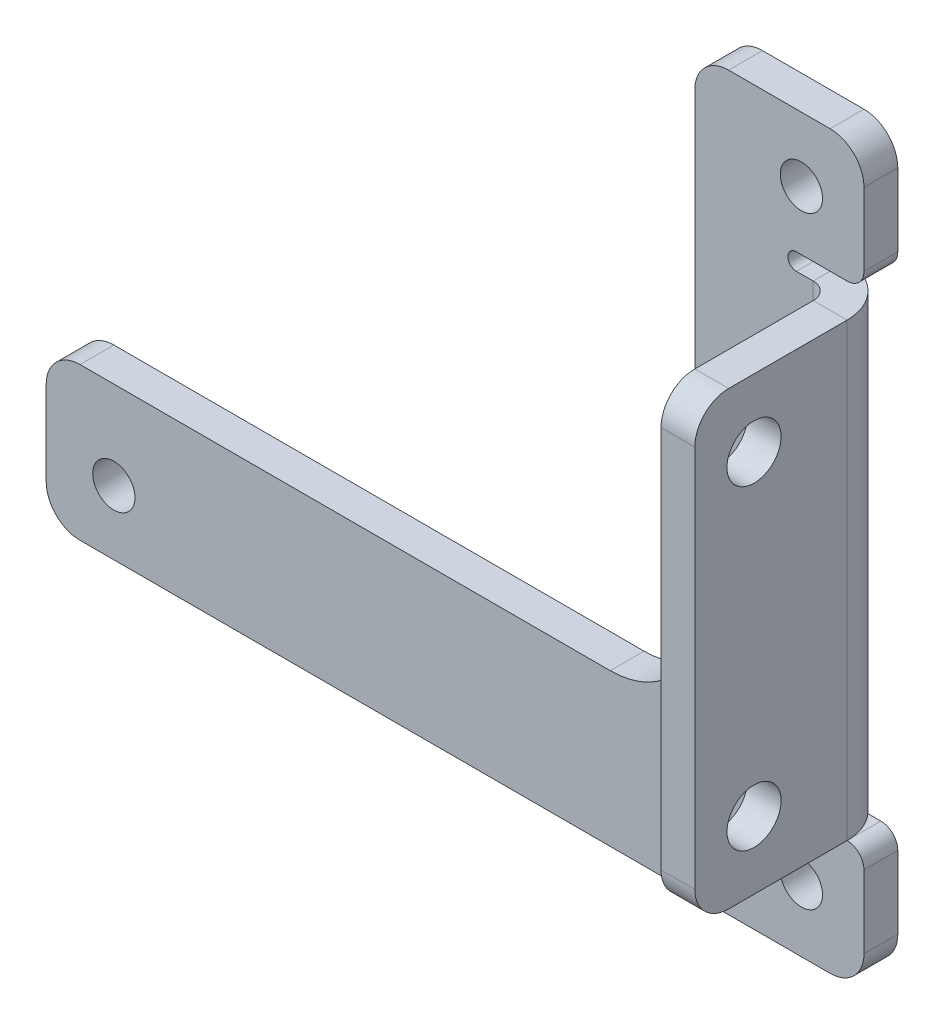
from build123d import *

# Parameters (mm, degrees)
SKETCH1_W                 = 48.35
SKETCH1_H                 = 43.25
BOSS_EXTRUDE2_DEPTH       = 2
EDGE_FLANGE1_START        = -4
EDGE_FLANGE1_OUTLINE_W    = 1
EDGE_FLANGE1_OUTLINE_H    = 2
EDGE_FLANGE1_DEPTH        = 4
EDGE_FLANGE1_START_2      = -1
EDGE_FLANGE1_2_DEPTH      = 3.09178
EDGE_FLANGE1_START_3      = 2
EDGE_FLANGE1_3_OUTLINE_W  = 2
EDGE_FLANGE1_3_OUTLINE_H  = 26.65
EDGE_FLANGE1_3_DEPTH      = 10
EDGE_FLANGE1_START_4      = 8.3
EDGE_FLANGE1_4_DEPTH      = 26.65
EDGE_FLANGE1_5_DEPTH      = 26.65
EDGE_FLANGE1_START_5      = 46.35
EDGE_FLANGE1_6_OUTLINE_R  = 1.6
EDGE_FLANGE1_6_DEPTH      = 2
REDONDEO1_R               = 2
TALADRO_ROSCADO_M31_D     = 2.5
TALADRO_ROSCADO_M31_DEPTH = 8.5
TALADRO_ROSCADO_M31_TIP   = 0.751075774
CROQUIS4_W                = 38.35
CROQUIS4_H                = 34.25
CORTAR_EXTRUIR1_DEPTH     = 66.637527376
FILLET1_R                 = 2
REDONDEO2_R               = 5
REDONDEO3_R               = 1


with BuildPart() as part:
    # Sketch1 → Boss-Extrude2 (new body)
    with BuildSketch(Plane.XY):
        with Locations((24.175, 21.625)):
            Rectangle(SKETCH1_W, SKETCH1_H)
    extrude(amount=BOSS_EXTRUDE2_DEPTH)

    # Edge-Flange1: read off the stored shape, not the designer's step
    # Edge-Flange1 outline → Edge-Flange1 (cut)
    with BuildSketch(Plane(origin=(48.35, 0, 2), x_dir=(0, 1, 0), z_dir=(1, 0, 0)).offset(EDGE_FLANGE1_START)):
        with Locations((35.45, -1)):
            Rectangle(EDGE_FLANGE1_OUTLINE_W, EDGE_FLANGE1_OUTLINE_H)
        with Locations((7.8, -1)):
            Rectangle(EDGE_FLANGE1_OUTLINE_W, EDGE_FLANGE1_OUTLINE_H)
    extrude(amount=EDGE_FLANGE1_DEPTH, mode=Mode.SUBTRACT)

    # Edge-Flange1 2 outline → Edge-Flange1 2 (cut)
    with BuildSketch(Plane.XY.offset(EDGE_FLANGE1_START_2)):
        with BuildLine():
            Line((44.35, 7.3), (44.35, 8.3))
            ThreePointArc((44.35, 8.3), (43.85, 7.8), (44.35, 7.3))
        make_face()
        with BuildLine():
            ThreePointArc((44.35, 35.95), (43.85, 35.45), (44.35, 34.95))
            Line((44.35, 34.95), (44.35, 35.95))
        make_face()
    extrude(amount=EDGE_FLANGE1_2_DEPTH, mode=Mode.SUBTRACT)

    # Edge-Flange1 3 outline → Edge-Flange1 3 (add)
    with BuildSketch(Plane.XY.offset(EDGE_FLANGE1_START_3)):
        with Locations((47.35, 21.625)):
            Rectangle(EDGE_FLANGE1_3_OUTLINE_W, EDGE_FLANGE1_3_OUTLINE_H)
    extrude(amount=EDGE_FLANGE1_3_DEPTH)

    # Edge-Flange1 4 outline → Edge-Flange1 4 (add)
    with BuildSketch(Plane(origin=(0, 0, 0), x_dir=(1, 0, 0), z_dir=(0, 1, 0)).offset(EDGE_FLANGE1_START_4)):
        with BuildLine():
            Line((46.35, -3), (46.35, -2))
            Line((46.35, -2), (45.35, -2))
            ThreePointArc((45.35, -2), (46.057106781, -2.292893219), (46.35, -3))
        make_face()
    extrude(amount=EDGE_FLANGE1_4_DEPTH)

    # Edge-Flange1 5 outline → Edge-Flange1 5 (cut)
    with BuildSketch(Plane(origin=(0, 0, 0), x_dir=(1, 0, 0), z_dir=(0, 1, 0)).offset(EDGE_FLANGE1_START_4)):
        with BuildLine():
            Line((48.35, -3), (48.35, 0))
            Line((48.35, 0), (45.35, 0))
            ThreePointArc((45.35, 0), (47.471320344, -0.878679656), (48.35, -3))
        make_face()
    extrude(amount=EDGE_FLANGE1_5_DEPTH, mode=Mode.SUBTRACT)

    # Edge-Flange1 6 outline → Edge-Flange1 6 (cut)
    with BuildSketch(Plane.YZ.offset(EDGE_FLANGE1_START_5)):
        with Locations((12.3, 8.5)):
            Circle(EDGE_FLANGE1_6_OUTLINE_R)
        with Locations((30.95, 8.5)):
            Circle(EDGE_FLANGE1_6_OUTLINE_R)
    extrude(amount=EDGE_FLANGE1_6_DEPTH, mode=Mode.SUBTRACT)

    # Redondeo1
    redondeo1_edges = [part.edges().sort_by_distance(p)[0] for p in [
        (47.35, 8.3, 12),
        (47.35, 34.95, 12),
    ]]
    fillet(redondeo1_edges, radius=REDONDEO1_R)

    # Taladro roscado M31
    with Locations(Plane(origin=(0, 0, 0), x_dir=(-1, 0, 0), z_dir=(0, 0, -1))):
        with Locations((-44.65, 39.45), (-4, 3.8), (-44.65, 3.8)):
            Hole(TALADRO_ROSCADO_M31_D / 2, depth=TALADRO_ROSCADO_M31_DEPTH)
            with Locations((0, 0, -(TALADRO_ROSCADO_M31_DEPTH + TALADRO_ROSCADO_M31_TIP / 2))):  # 118° drill point
                Cone(0, TALADRO_ROSCADO_M31_D / 2, TALADRO_ROSCADO_M31_TIP, mode=Mode.SUBTRACT)

    # Croquis4 → Cortar-Extruir1 (cut, through all)
    with BuildSketch(Plane.XY.offset(2)):
        with Locations((19.175, 26.125)):
            Rectangle(CROQUIS4_W, CROQUIS4_H)
    extrude(amount=-CORTAR_EXTRUIR1_DEPTH, mode=Mode.SUBTRACT)

    # Fillet1
    fillet1_edges = [part.edges().sort_by_distance(p)[0] for p in [
        (0, 9, 1),
        (38.35, 43.25, 1),
        (0, 0, 1),
        (48.35, 43.25, 1),
        (48.35, 0, 1),
    ]]
    fillet(fillet1_edges, radius=FILLET1_R)

    # Redondeo2
    redondeo2_edges = [part.edges().sort_by_distance(p)[0] for p in [
        (38.35, 9, 1),
    ]]
    fillet(redondeo2_edges, radius=REDONDEO2_R)

    # Redondeo3
    redondeo3_edges = [part.edges().sort_by_distance(p)[0] for p in [
        (48.35, 35.95, 1),
        (48.35, 7.3, 1),
    ]]
    fillet(redondeo3_edges, radius=REDONDEO3_R)


solid = part.part
